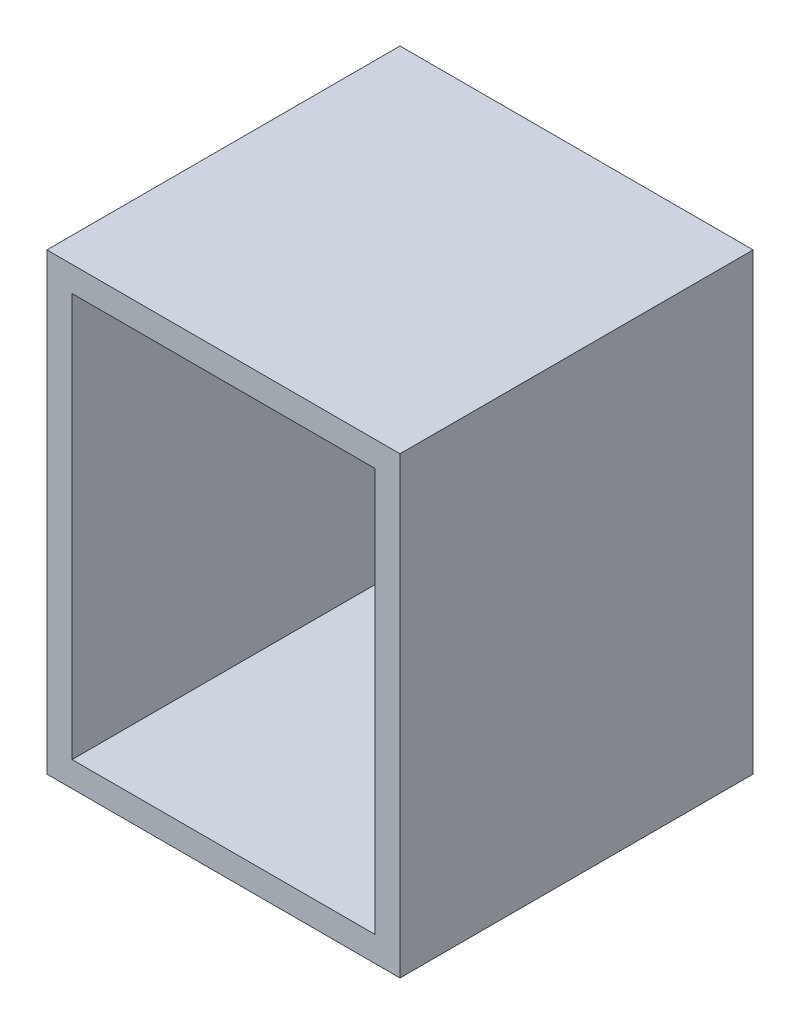
from build123d import *

# Parameters (mm, degrees)
SKETCH4_W           = 35
SKETCH4_H           = 45
BOSS_EXTRUDE2_DEPTH = 35
SKETCH5_OUTSIDE_W   = 50.38
SKETCH5_OUTSIDE_H   = 60.38
SKETCH5_OUTSIDE_W_2 = 35
SKETCH5_OUTSIDE_H_2 = 45
SKETCH5_OUTSIDE_W_3 = 30
SKETCH5_OUTSIDE_H_3 = 40
CUT_EXTRUDE1_DEPTH  = 32.5


with BuildPart() as part:
    # Sketch4 → Boss-Extrude2 (new body)
    with BuildSketch(Plane.XY):
        with Locations((-2.784904398, -1.939291809)):
            Rectangle(SKETCH4_W, SKETCH4_H)
    extrude(amount=BOSS_EXTRUDE2_DEPTH)

    # Sketch5 outside → Cut-Extrude1 (cut)
    # profile 1 of 2: a face of its own
    with BuildSketch(Plane.XY.offset(35)):
        with Locations((-2.785, -1.939)):
            Rectangle(SKETCH5_OUTSIDE_W, SKETCH5_OUTSIDE_H)
        with Locations((-2.784904398, -1.939291809)):
            Rectangle(SKETCH5_OUTSIDE_W_2, SKETCH5_OUTSIDE_H_2, mode=Mode.SUBTRACT)
    # profile 2 of 2: a face of its own
    with BuildSketch(Plane.XY.offset(35)):
        with Locations((-2.784904398, -1.939291809)):
            Rectangle(SKETCH5_OUTSIDE_W_3, SKETCH5_OUTSIDE_H_3)
    extrude(amount=-CUT_EXTRUDE1_DEPTH, mode=Mode.SUBTRACT)


solid = part.part
